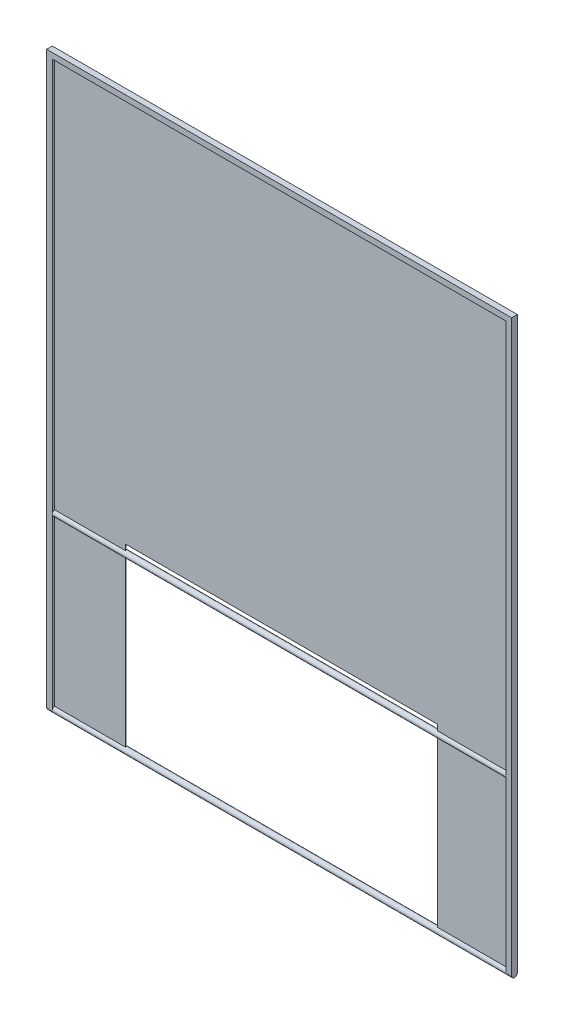
from build123d import *

# Parameters (mm, degrees)
SWEEP2_PROFILE_R    = 5
SWEEP3_PROFILE_R    = 5
EXTRUDE_THIN2_DEPTH = 5
FILLET4_R           = 5
BOSS_EXTRUDE1_DEPTH = 1


with BuildPart() as part:
    # Sweep2: sweep along a path in Sketch14
    with BuildLine(Plane.XY) as sweep2_path:
        Line((-400, 0), (400, 0))
    # Sweep2 profile (on start of the path) → Sweep2 (sweep)
    with BuildSketch(Plane(origin=(-400, 0, 0), x_dir=(0, 0, 1), z_dir=(1, 0, 0))):
        Circle(SWEEP2_PROFILE_R)
    sweep(path=sweep2_path.line)



with BuildPart() as body_2:
    # Sweep3: sweep along a path in Sketch14<3>
    with BuildLine(Plane.XY) as sweep3_path:
        Line((-400, 300), (400, 300))
    # Sweep3 profile (on start of the path) → Sweep3 (sweep)
    with BuildSketch(Plane(origin=(-400, 300, 0), x_dir=(0, 0, 1), z_dir=(1, 0, 0))):
        Circle(SWEEP3_PROFILE_R)
    sweep(path=sweep3_path.line)


with BuildPart() as part_1:
    add(part.part)

    add(body_2.part)  # Extrude-Thin2 merges body 2
    # Sketch31 → Extrude-Thin2 (add, symmetric)
    with BuildSketch(Plane.XY):
        Polygon((400, -5), (400, 995), (-400, 995), (-400, -5), (-410, -5), (-410, 1005), (410, 1005), (410, -5), align=None)
    extrude(amount=EXTRUDE_THIN2_DEPTH, both=True)

    # Fillet4
    fillet4_edges = [part_1.edges().sort_by_distance(p)[0] for p in [
        (405, -5, -5),
        (405, -5, 5),
        (-410, -5, 0),
        (-405, -5, 5),
    ]]
    fillet(fillet4_edges, radius=FILLET4_R - 0.0001)  # a hair under: the kernel refuses the full size

    # Sketch32 → Boss-Extrude1 (add)
    with BuildSketch(Plane.XY):
        Polygon((275, 0), (275, 315), (-275, 315), (-275, 0), (-410, 0), (-410, 1005), (410, 1005), (410, 0), align=None)
    extrude(amount=BOSS_EXTRUDE1_DEPTH)


solid = part_1.part
